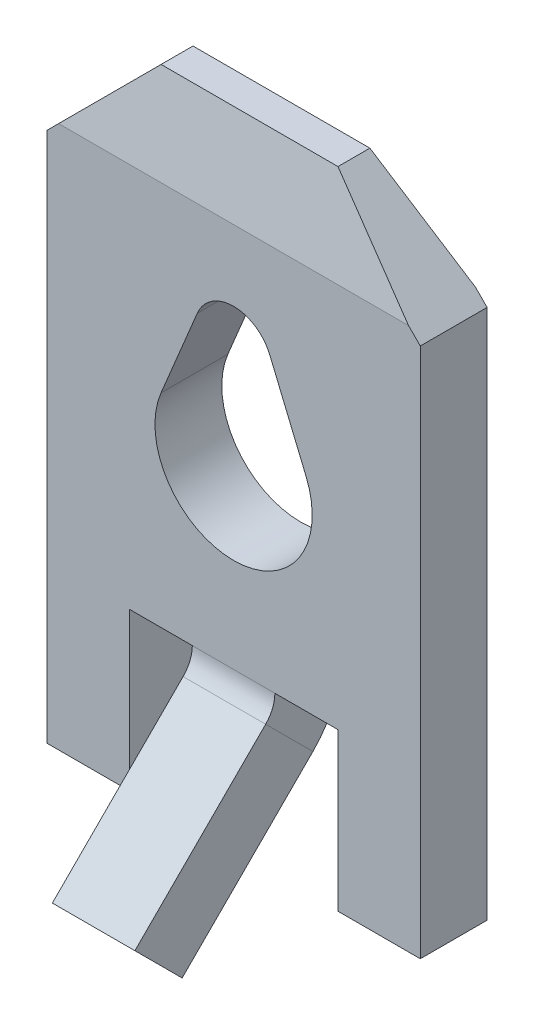
from build123d import *

# Parameters (mm, degrees)
BOSS_EXTRUDE1_DEPTH    = 4.75
CUT_EXTRUDE1_REACH     = 11.471
CUT_EXTRUDE2_DEPTH     = 0.85
SKETCH6_W              = 0.8
SKETCH6_H              = 2
CUT_EXTRUDE3_DEPTH     = 0.85
SKETCH7_W              = 1.05
SKETCH7_H              = 0.85
BOSS_EXTRUDE2_DEPTH    = 1
SKETCHED_START         = 1.85
SKETCHED_BEND1_DEPTH   = 1.05
SKETCHED_BEND1_2_DEPTH = 1.05


# Read off the part's stored shape, not the designer's step: Sketched Bend1
with BuildPart() as part:
    # Sketch1 → Boss-Extrude1 (new body)
    with BuildSketch(Plane(origin=(0, 0, 0), x_dir=(0, 0, -1), z_dir=(1, 0, 0))):
        Polygon((0, 0.15), (0, 7.05), (-0.241393443, 8.15), (-0.647131148, 8.15), (-0.85, 7.05), (-0.85, 0.15), align=None)
    extrude(amount=BOSS_EXTRUDE1_DEPTH)

    # Cut-Extrude1: up to this face of the body (flat: up to its plane)
    cut_extrude1_end = Plane(part.part.faces().sort_by_distance((2.375, 3.6, 0))[0])
    # Sketch4 → Cut-Extrude1 (cut, up to the picked face)
    with BuildSketch(Plane.XY.offset(0.85), mode=Mode.PRIVATE) as cut_extrude1_sk1:
        Polygon((0, 6.9), (1.25, 8.15), (0, 8.15), align=None)
    cut_extrude1_tool1 = split(extrude(cut_extrude1_sk1.sketch, amount=-CUT_EXTRUDE1_REACH, mode=Mode.PRIVATE), bisect_by=cut_extrude1_end, keep=Keep.BOTH, mode=Mode.PRIVATE)
    # Sketch4 → Cut-Extrude1 (cut, up to the picked face)
    with BuildSketch(Plane.XY.offset(0.85), mode=Mode.PRIVATE) as cut_extrude1_sk2:
        Polygon((3.5, 8.15), (4.75, 6.9), (4.75, 8.15), align=None)
    cut_extrude1_tool2 = split(extrude(cut_extrude1_sk2.sketch, amount=-CUT_EXTRUDE1_REACH, mode=Mode.PRIVATE), bisect_by=cut_extrude1_end, keep=Keep.BOTH, mode=Mode.PRIVATE)
    add(cut_extrude1_tool1.solids().sort_by(Axis((0.416667, 7.733333, 0.85), (0, 0, -1)))[0], mode=Mode.SUBTRACT)
    add(cut_extrude1_tool2.solids().sort_by(Axis((4.333333, 7.733333, 0.85), (0, 0, -1)))[0], mode=Mode.SUBTRACT)

    # Sketch5 → Cut-Extrude2 (cut)
    with BuildSketch(Plane.XY.offset(0.85)):
        with BuildLine():
            Line((1.913461538, 5.842307692), (1.451923077, 4.734615385))
            ThreePointArc((1.451923077, 4.734615385), (2.37510742, 3.350000006), (3.297994271, 4.734813689))
            Line((3.297994271, 4.734813689), (2.842436975, 5.827489929))
            ThreePointArc((2.842436975, 5.827489929), (2.382974312, 6.149936406), (1.913461538, 5.842307692))
        make_face()
    extrude(amount=-CUT_EXTRUDE2_DEPTH, mode=Mode.SUBTRACT)

    # Sketch6 → Cut-Extrude3 (cut)
    with BuildSketch(Plane(origin=(0, 0, 0), x_dir=(-1, 0, 0), z_dir=(0, 0, -1))):
        with Locations((-3.3, 1.15)):
            Rectangle(SKETCH6_W, SKETCH6_H)
        with Locations((-1.45, 1.15)):
            Rectangle(SKETCH6_W, SKETCH6_H)
    extrude(amount=-CUT_EXTRUDE3_DEPTH, mode=Mode.SUBTRACT)

    # Sketch7 → Boss-Extrude2 (add)
    with BuildSketch(Plane.XZ.offset(-0.15)):
        with Locations((2.375, 0.425)):
            Rectangle(SKETCH7_W, SKETCH7_H)
    extrude(amount=BOSS_EXTRUDE2_DEPTH)

    # Sketched Bend1 outline → Sketched Bend1 (cut)
    with BuildSketch(Plane.YZ.offset(SKETCHED_START)):
        with BuildLine():
            Line((1.266116524, 0.366116524), (0.782233048, 0.85))
            Line((0.782233048, 0.85), (-0.85, 0.85))
            Line((-0.85, 0.85), (-0.85, 0))
            Line((-0.85, 0), (2.15, 0))
            ThreePointArc((2.15, 0), (1.67164571, 0.095150584), (1.266116524, 0.366116524))
        make_face()
    extrude(amount=SKETCHED_BEND1_DEPTH, mode=Mode.SUBTRACT)

    # Sketched Bend1 2 outline → Sketched Bend1 2 (add)
    with BuildSketch(Plane.YZ.offset(SKETCHED_START)):
        with BuildLine():
            ThreePointArc((2.15, 0.85), (1.996926627, 0.880448187), (1.867157288, 0.967157288))
            Line((1.867157288, 0.967157288), (0.204009247, 2.630305328))
            Line((0.204009247, 2.630305328), (-0.397031517, 2.029264564))
            Line((-0.397031517, 2.029264564), (0.782233048, 0.85))
            Line((0.782233048, 0.85), (2.15, 0.85))
        make_face()
    extrude(amount=SKETCHED_BEND1_2_DEPTH)


solid = part.part
